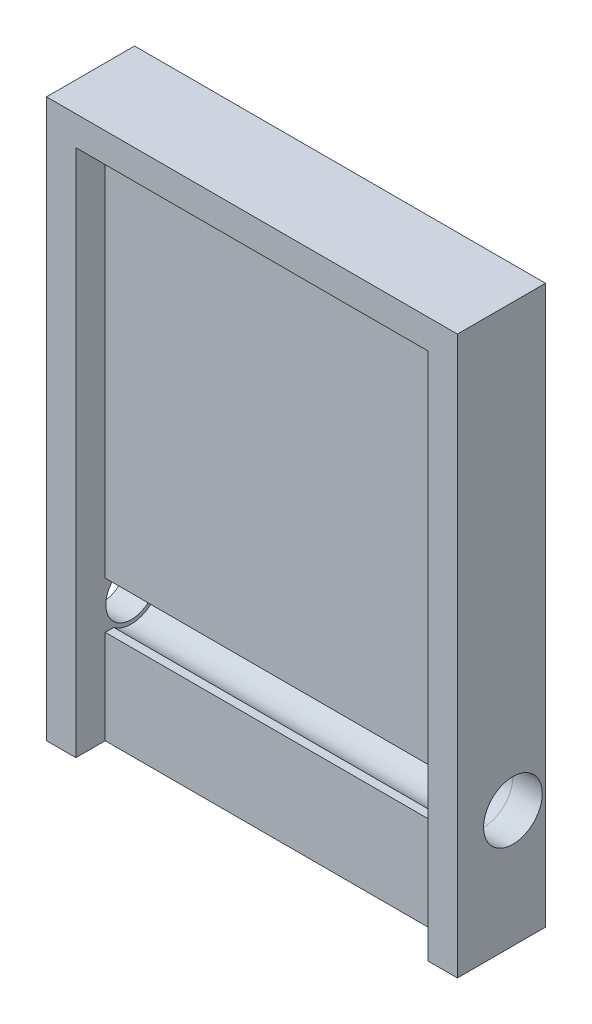
from build123d import *

# Parameters (mm, degrees)
SKETCH1_W               = 95
SKETCH1_H               = 70
BOSS_EXTRUDE1_DEPTH     = 15
SKETCH2_W               = 60
SKETCH2_H               = 90
CUT_EXTRUDE1_DEPTH      = 5
SKETCH4_W               = 60
SKETCH4_H               = 8
CUT_EXTRUDE2_DEPTH      = 4.45
CUT_REVOLVE_THIN1_START = -30
CUT_REVOLVE_THIN1_DEPTH = 60
SKETCH3_R               = 5
CUT_EXTRUDE3_DEPTH      = 82.891696771
SKETCH6_R               = 4.35
CUT_EXTRUDE4_DEPTH      = 86.914201387


# Read off the part's stored shape, not the designer's step: Cut-Revolve-Thin1
with BuildPart() as part:
    # Sketch1 → Boss-Extrude1 (new body)
    with BuildSketch(Plane(origin=(0, 0, 0), x_dir=(0, 1, 0), z_dir=(0, 0, 1))):
        Rectangle(SKETCH1_W, SKETCH1_H)
    extrude(amount=BOSS_EXTRUDE1_DEPTH)

    # Sketch2 → Cut-Extrude1 (cut)
    with BuildSketch(Plane.XY.offset(15)):
        with Locations((0, -2.5)):
            Rectangle(SKETCH2_W, SKETCH2_H)
    extrude(amount=-CUT_EXTRUDE1_DEPTH, mode=Mode.SUBTRACT)

    # Sketch4 → Cut-Extrude2 (cut)
    with BuildSketch(Plane.XY.offset(10)):
        with Locations((0, -27.5)):
            Rectangle(SKETCH4_W, SKETCH4_H)
    extrude(amount=-CUT_EXTRUDE2_DEPTH, mode=Mode.SUBTRACT)

    # Cut-Revolve-Thin1 outline → Cut-Revolve-Thin1 (cut)
    with BuildSketch(Plane.YZ.offset(CUT_REVOLVE_THIN1_START)):
        with BuildLine():
            Line((-31.5, 5.55), (-31.5, 8.55))
            ThreePointArc((-31.5, 8.55), (-27.5, 0.55), (-23.5, 8.55))
            Line((-23.5, 8.55), (-23.5, 5.55))
            Line((-23.5, 5.55), (-31.5, 5.55))
        make_face()
    extrude(amount=CUT_REVOLVE_THIN1_DEPTH, mode=Mode.SUBTRACT)

    # Sketch3 → Cut-Extrude3 (cut, through all)
    with BuildSketch(Plane(origin=(30, 0, 0), x_dir=(0, -1, 0), z_dir=(-1, 0, 0))):
        with Locations(Location((27.5, 5.546519225, 0), (0, 0, 179.980056627))):
            Circle(SKETCH3_R)
    extrude(amount=-CUT_EXTRUDE3_DEPTH, mode=Mode.SUBTRACT)

    # Sketch6 → Cut-Extrude4 (cut, through all)
    with BuildSketch(Plane(origin=(-35, 0, 0), x_dir=(0, -1, 0), z_dir=(-1, 0, 0))):
        with Locations(Location((27.5, 5.546519225, 0), (0, 0, 90))):
            Circle(SKETCH6_R)
    extrude(amount=-CUT_EXTRUDE4_DEPTH, mode=Mode.SUBTRACT)


solid = part.part
